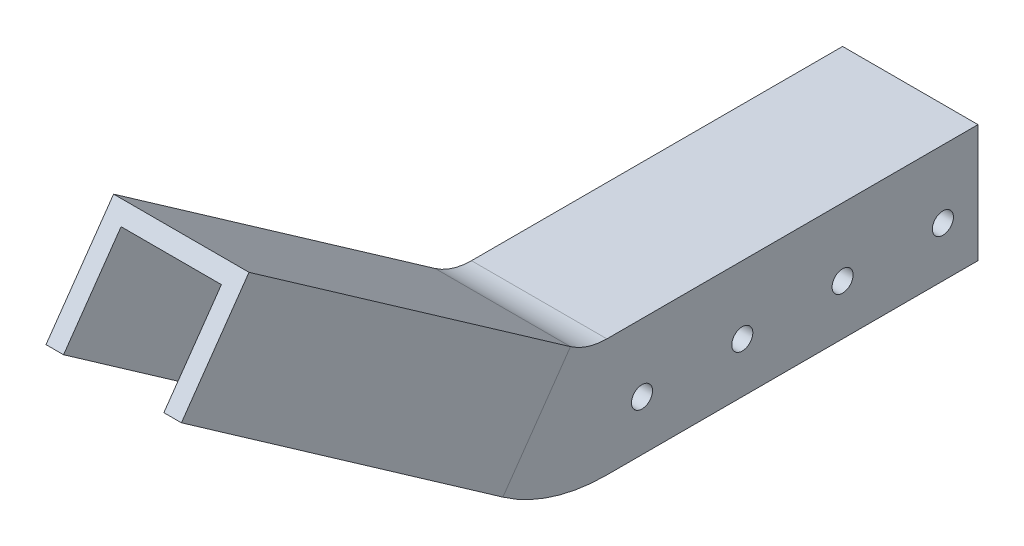
from build123d import *

# Parameters (mm, degrees)
SKETCH1_W           = 27
SKETCH1_H           = 24
BOSS_EXTRUDE1_DEPTH = 37
SHELL1_T            = -3.5
SKETCH3_R           = 2.1
CUT_EXTRUDE1_DEPTH  = 48.349762407
SKETCH5_W           = 74
SKETCH5_H           = 0.5
CUT_EXTRUDE3_DEPTH  = 48.349762407
SWEEP1_START        = -13.5
SWEEP1_DEPTH        = 27
SWEEP1_2_DEPTH      = 3.5
SWEEP1_START_2      = 10
SWEEP1_3_DEPTH      = 3.5


# Read off the part's stored shape, not the designer's step: Sweep1
with BuildPart() as part:
    # Sketch1 → Boss-Extrude1 (new, symmetric)
    with BuildSketch(Plane.XY):
        Rectangle(SKETCH1_W, SKETCH1_H)
    extrude(amount=BOSS_EXTRUDE1_DEPTH, both=True)

    # Shell1
    shell1_openings = [part.faces().sort_by_distance(p)[0] for p in [
        (0, 0, 37),
        (0, 0, -37),
        (0, -12, 0),
    ]]
    offset(amount=SHELL1_T, openings=shell1_openings, kind=Kind.INTERSECTION)

    # Sketch3 → Cut-Extrude1 (cut, through all)
    with BuildSketch(Plane.ZY.offset(13.5)):
        with Locations((-30, -1.5)):
            Circle(SKETCH3_R)
        with Locations((-10, -1.5)):
            Circle(SKETCH3_R)
        with Locations((10, -1.5)):
            Circle(SKETCH3_R)
        with Locations((30, -1.5)):
            Circle(SKETCH3_R)
    extrude(amount=-CUT_EXTRUDE1_DEPTH, mode=Mode.SUBTRACT)

    # Sketch5 → Cut-Extrude3 (cut, through all)
    with BuildSketch(Plane.ZY.offset(13.5)):
        with Locations((0, -11.75)):
            Rectangle(SKETCH5_W, SKETCH5_H)
    extrude(amount=-CUT_EXTRUDE3_DEPTH, mode=Mode.SUBTRACT)

    # Sweep1 outline → Sweep1 (add)
    with BuildSketch(Plane.YZ.offset(SWEEP1_START)):
        with BuildLine():
            Line((14.288034431, 44.256718109), (59.173181861, 108.359351944))
            Line((59.173181861, 108.359351944), (56.306149706, 110.366869471))
            Line((56.306149706, 110.366869471), (11.421002276, 46.264235636))
            ThreePointArc((11.421002276, 46.264235636), (9.247550016, 41.856910443), (8.5, 37))
            Line((8.5, 37), (12, 37))
            ThreePointArc((12, 37), (12.585559344, 40.804440145), (14.288034431, 44.256718109))
        make_face()
    extrude(amount=SWEEP1_DEPTH)

    # Sweep1 2 outline → Sweep1 2 (add)
    with BuildSketch(Plane.YZ.offset(SWEEP1_START)):
        with BuildLine():
            Line((11.421002276, 46.264235636), (56.306149706, 110.366869471))
            Line((56.306149706, 110.366869471), (39.923108821, 121.838398198))
            Line((39.923108821, 121.838398198), (-4.96203861, 57.735764364))
            ThreePointArc((-4.96203861, 57.735764364), (-9.826788999, 47.871026434), (-11.5, 37))
            Line((-11.5, 37), (8.5, 37))
            ThreePointArc((8.5, 37), (9.247550016, 41.856910443), (11.421002276, 46.264235636))
        make_face()
    extrude(amount=SWEEP1_2_DEPTH)

    # Sweep1 3 outline → Sweep1 3 (add)
    with BuildSketch(Plane.YZ.offset(SWEEP1_START_2)):
        with BuildLine():
            Line((11.421002276, 46.264235636), (56.306149706, 110.366869471))
            Line((56.306149706, 110.366869471), (39.923108821, 121.838398198))
            Line((39.923108821, 121.838398198), (-4.96203861, 57.735764364))
            ThreePointArc((-4.96203861, 57.735764364), (-9.826788999, 47.871026434), (-11.5, 37))
            Line((-11.5, 37), (8.5, 37))
            ThreePointArc((8.5, 37), (9.247550016, 41.856910443), (11.421002276, 46.264235636))
        make_face()
    extrude(amount=SWEEP1_3_DEPTH)


solid = part.part
